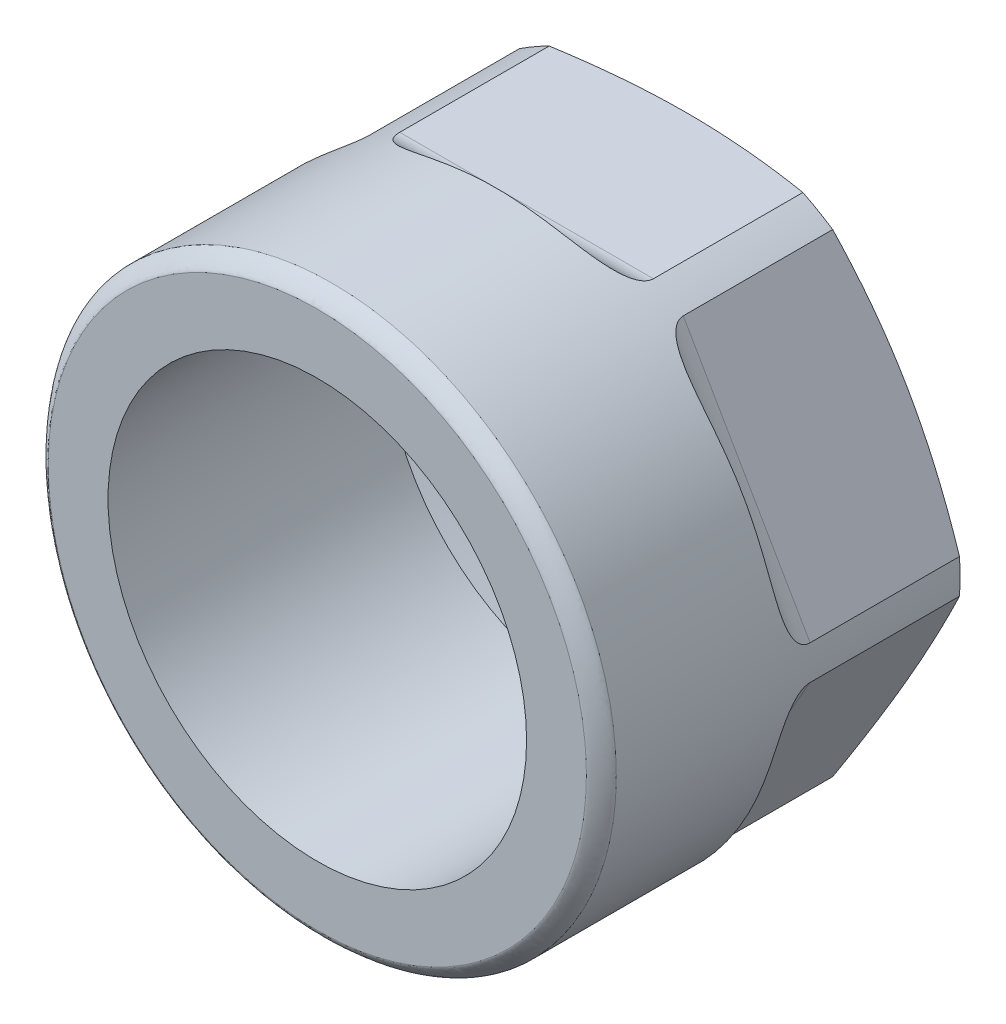
from build123d import *
from build123d.topology import SkipClean

# Parameters (mm, degrees)
ESBO_O1_R                   = 9.5
RESSALTO_EXTRUS_O1_DEPTH    = 6
RESSALTO_EXTRUS_O3_START    = 7
RESSALTO_EXTRUS_O3_DEPTH    = 7
FILETE2_R                   = 1
FILETE5_SIZE                = 0.5
ESBO_O11_R                  = 7
CORTE_EXTRUS_O11_DEPTH      = 7
CORTE_EXTRUS_O12_DEPTH      = 21
CORTE_EXTRUS_O12_DEPTH_BACK = 25
ESBO_O13_R                  = 4.3
CHANFRO7_SIZE               = 3
CHANFRO7_SIZE_2             = 11.196152423


with BuildPart() as part:
    # Esboço1 → Ressalto-extrusão1 (new body)
    with BuildSketch(Plane.XY):
        Circle(ESBO_O1_R)
    extrude(amount=RESSALTO_EXTRUS_O1_DEPTH)

    # Esboço6 → Ressalto-extrusão3 (add)
    with SkipClean():  # the faces are left unmerged after this step: merging them gives an invalid solid
        with BuildSketch(Plane(origin=(0, 0, 0), x_dir=(-1, 0, 0), z_dir=(0, 0, -1)).offset(RESSALTO_EXTRUS_O3_START)):
            with BuildLine():
                Line((4.242640687, 8.5), (-4.242640687, 8.5))
                ThreePointArc((-4.242640687, 8.5), (-4.75, 8.227241336), (-5.239895589, 7.924234614))
                Line((-5.239895589, 7.924234614), (-9.482536276, 0.575765386))
                ThreePointArc((-9.482536276, 0.575765386), (-9.5, 0), (-9.482536276, -0.575765386))
                Line((-9.482536276, -0.575765386), (-5.239895589, -7.924234614))
                ThreePointArc((-5.239895589, -7.924234614), (-4.75, -8.227241336), (-4.242640687, -8.5))
                Line((-4.242640687, -8.5), (4.242640687, -8.5))
                ThreePointArc((4.242640687, -8.5), (4.75, -8.227241336), (5.239895589, -7.924234614))
                Line((5.239895589, -7.924234614), (9.482536276, -0.575765386))
                ThreePointArc((9.482536276, -0.575765386), (9.5, 0), (9.482536276, 0.575765386))
                Line((9.482536276, 0.575765386), (5.239895589, 7.924234614))
                ThreePointArc((5.239895589, 7.924234614), (4.75, 8.227241336), (4.242640687, 8.5))
            make_face()
        extrude(amount=-RESSALTO_EXTRUS_O3_DEPTH)

    # Filete2
    # the kernel refuses this fillet: 1 mm, written as the material it adds along each edge
    with BuildSketch(Plane(origin=(3.989895589, 10.089298124, 0), x_dir=(0.8660254037844385, 0.5000000000000003, 0), z_dir=(0.5000000000000003, -0.8660254037844385, 0))) as filete2_piece_1_section:
        with BuildLine():
            CenterArc((FILETE2_R, -FILETE2_R), FILETE2_R, 90, 90)
            Line((0, -FILETE2_R), (0, 0))
            Line((0, 0), (FILETE2_R, 0))
        make_face()
    filete2_piece_1 = extrude(amount=13.485281374, mode=Mode.PRIVATE)
    filete2_piece_1 = filete2_piece_1 & Plane(origin=(0, 0, 0), x_dir=(1, 0, 0), z_dir=(0, 0, -1)) * Cylinder(9.5, 31, mode=Mode.PRIVATE)
    add(filete2_piece_1)
    with BuildSketch(Plane(origin=(10.732536276, 1.589298124, 0), x_dir=(0.8660254037844389, -0.4999999999999998, 0), z_dir=(-0.4999999999999998, -0.8660254037844388, 0))) as filete2_piece_2_section:
        with BuildLine():
            CenterArc((FILETE2_R, -FILETE2_R), FILETE2_R, 90, 90)
            Line((0, -FILETE2_R), (0, 0))
            Line((0, 0), (FILETE2_R, 0))
        make_face()
    filete2_piece_2 = extrude(amount=13.485281374, mode=Mode.PRIVATE)
    filete2_piece_2 = filete2_piece_2 & Plane(origin=(0, 0, 0), x_dir=(1, 0, 0), z_dir=(0, 0, -1)) * Cylinder(9.5, 31, mode=Mode.PRIVATE)
    add(filete2_piece_2)
    with BuildSketch(Plane(origin=(6.742640687, -8.5, 0), x_dir=(0, -1, 0), z_dir=(-1, 0, 0))) as filete2_piece_3_section:
        with BuildLine():
            CenterArc((FILETE2_R, -FILETE2_R), FILETE2_R, 90, 90)
            Line((0, -FILETE2_R), (0, 0))
            Line((0, 0), (FILETE2_R, 0))
        make_face()
    filete2_piece_3 = extrude(amount=13.485281374, mode=Mode.PRIVATE)
    filete2_piece_3 = filete2_piece_3 & Plane(origin=(0, 0, 0), x_dir=(1, 0, 0), z_dir=(0, 0, -1)) * Cylinder(9.5, 31, mode=Mode.PRIVATE)
    add(filete2_piece_3)
    with BuildSketch(Plane(origin=(-3.989895589, -10.089298124, 0), x_dir=(-0.8660254037844385, -0.5000000000000004, 0), z_dir=(-0.5000000000000004, 0.8660254037844385, 0))) as filete2_piece_4_section:
        with BuildLine():
            CenterArc((FILETE2_R, -FILETE2_R), FILETE2_R, 90, 90)
            Line((0, -FILETE2_R), (0, 0))
            Line((0, 0), (FILETE2_R, 0))
        make_face()
    filete2_piece_4 = extrude(amount=13.485281374, mode=Mode.PRIVATE)
    filete2_piece_4 = filete2_piece_4 & Plane(origin=(0, 0, 0), x_dir=(1, 0, 0), z_dir=(0, 0, -1)) * Cylinder(9.5, 31, mode=Mode.PRIVATE)
    add(filete2_piece_4)
    with BuildSketch(Plane(origin=(-6.742640687, 8.5, 0), x_dir=(0, 1, 0), z_dir=(1, 0, 0))) as filete2_piece_5_section:
        with BuildLine():
            CenterArc((FILETE2_R, -FILETE2_R), FILETE2_R, 90, 90)
            Line((0, -FILETE2_R), (0, 0))
            Line((0, 0), (FILETE2_R, 0))
        make_face()
    filete2_piece_5 = extrude(amount=13.485281374, mode=Mode.PRIVATE)
    filete2_piece_5 = filete2_piece_5 & Plane(origin=(0, 0, 0), x_dir=(1, 0, 0), z_dir=(0, 0, -1)) * Cylinder(9.5, 31, mode=Mode.PRIVATE)
    add(filete2_piece_5)
    with BuildSketch(Plane(origin=(-10.732536276, -1.589298124, 0), x_dir=(-0.8660254037844387, 0.49999999999999994, 0), z_dir=(0.49999999999999994, 0.8660254037844387, 0))) as filete2_piece_6_section:
        with BuildLine():
            CenterArc((FILETE2_R, -FILETE2_R), FILETE2_R, 90, 90)
            Line((0, -FILETE2_R), (0, 0))
            Line((0, 0), (FILETE2_R, 0))
        make_face()
    filete2_piece_6 = extrude(amount=13.485281374, mode=Mode.PRIVATE)
    filete2_piece_6 = filete2_piece_6 & Plane(origin=(0, 0, 0), x_dir=(1, 0, 0), z_dir=(0, 0, -1)) * Cylinder(9.5, 31, mode=Mode.PRIVATE)
    add(filete2_piece_6)

    # Filete5
    # a fillet whose section is not a circle: 0.5 mm, written as the material it takes off along each edge
    with BuildSketch(Plane(origin=(0, 0, 6), x_dir=(1, 0, 0), z_dir=(0, -1, 0))) as filete5_piece_1:
        with BuildLine():
            Bezier((9.5, -FILETE5_SIZE), (9.5, 0), (9.5 - FILETE5_SIZE, 0), weights=[1, 0.176776695, 1])
            Line((9.5 - FILETE5_SIZE, 0), (9.5, 0))
            Line((9.5, 0), (9.5, -FILETE5_SIZE))
        make_face()
    revolve(axis=Axis((0, 0, 6), (0, 0, 1)), mode=Mode.SUBTRACT)

    # Esboço11 → Corte-extrusão11 (cut)
    with BuildSketch(Plane.XY.offset(6)):
        Circle(ESBO_O11_R)
    extrude(amount=-CORTE_EXTRUS_O11_DEPTH, mode=Mode.SUBTRACT)

    # Esboço13 → Corte-extrusão12 (cut, two sides: drawn at the far end of the back side and taken through both)
    with BuildSketch(Plane(origin=(0, 0, -7), x_dir=(-1, 0, 0), z_dir=(0, 0, -1)).offset(-CORTE_EXTRUS_O12_DEPTH_BACK)):
        with Locations(Location((0, 0, 0), (0, 0, 180))):
            Circle(ESBO_O13_R)
    extrude(amount=CORTE_EXTRUS_O12_DEPTH + CORTE_EXTRUS_O12_DEPTH_BACK, mode=Mode.SUBTRACT)

    # Chanfro7
    # the kernel refuses this chamfer: 11.196152423, 3 mm, written as the material it takes off along each edge
    with BuildSketch(Plane(origin=(0, 0, -1), x_dir=(1, 0, 0), z_dir=(0, 1, 0))) as chanfro7_piece_1_section:
        Polygon((4.3, CHANFRO7_SIZE), (4.3 + CHANFRO7_SIZE_2, 0), (4.3, 0), align=None)
    chanfro7_piece_1 = revolve(axis=Axis((0, 0, -1), (0, 0, -1)), mode=Mode.PRIVATE)
    chanfro7_piece_1 = chanfro7_piece_1 & Plane(origin=(0, 0, -1), x_dir=(1, 0, 0), z_dir=(0, 0, 1)) * Cylinder(7, 62, mode=Mode.PRIVATE)
    add(chanfro7_piece_1, mode=Mode.SUBTRACT)

    # Filete6
    # a fillet whose section is not a circle: 2.5 mm, written as the material it takes off along each edge
    with BuildSketch(Plane(origin=(0, 0, -4), x_dir=(1, 0, 0), z_dir=(0, 1, 0))) as filete6_piece_1:
        with BuildLine():
            Bezier((4.3, 1.91831747), (4.3, 0), (6.152952387, -0.496497096), weights=[1, 0.991691675, 1])
            Line((6.152952387, -0.496497096), (4.3, 0))
            Line((4.3, 0), (4.3, 1.91831747))
        make_face()
    revolve(axis=Axis((0, 0, -4), (0, 0, -1)), mode=Mode.SUBTRACT)

    # Corte-extrusão13: read off the stored shape, not the designer's step
    # Corte-extrusão13 outline → Corte-extrusão13 (revolve, cut)
    with BuildSketch(Plane.XZ):
        Polygon((9.500000154, -5.9990818), (6.75, -7), (9.500000154, -7), align=None)
    revolve(axis=Axis((0, 0, 0), (0, 0, 1)), mode=Mode.SUBTRACT)


solid = part.part
